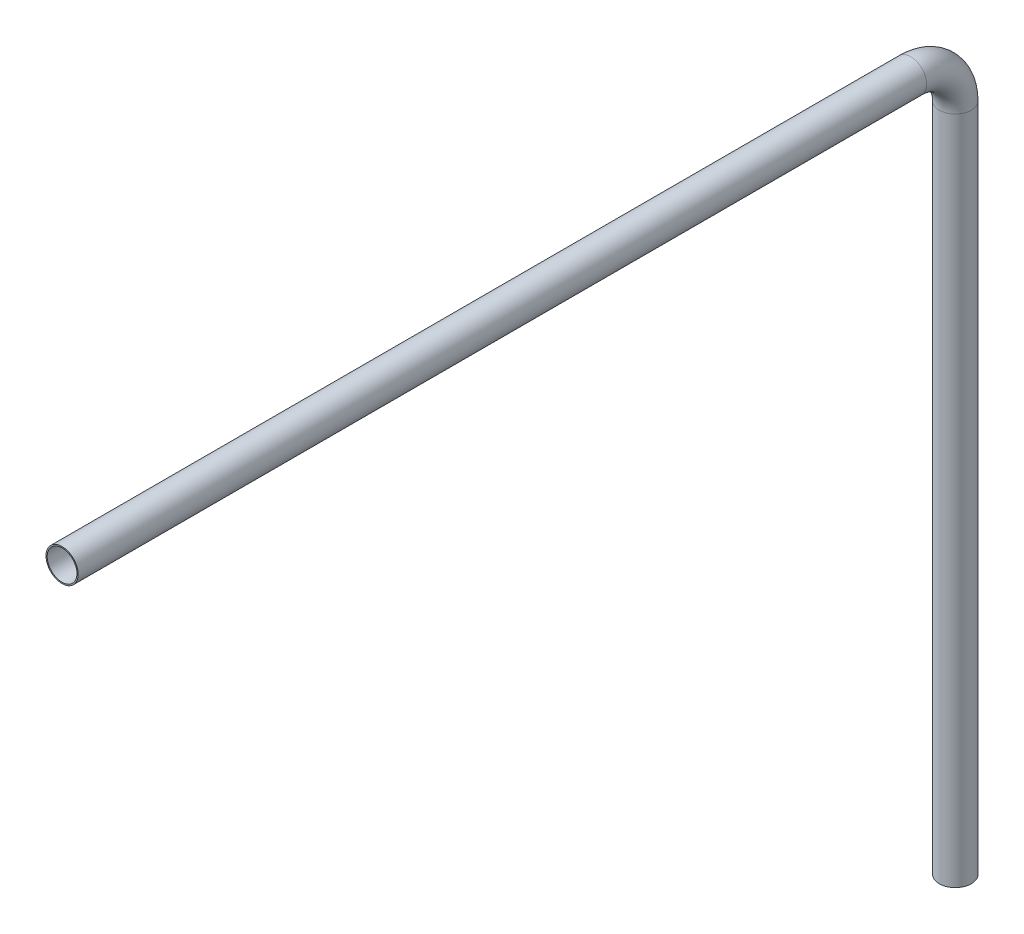
from build123d import *

# Parameters (mm, degrees)
SKETCH2_R           = 54
SKETCH2_R_2         = 50
SKETCH3_R           = 54
SKETCH3_R_2         = 50
BOSS_EXTRUDE1_DEPTH = 400


with BuildPart() as part:
    # Sweep1: sweep along a path in Sketch1
    with BuildLine(Plane(origin=(0, 0, 0), x_dir=(0, 0, -1), z_dir=(1, 0, 0))) as sweep1_path:
        Line((0, 0), (0, 1850))
        ThreePointArc((0, 1850), (-43.933982822, 1956.066017178), (-150, 2000))
        Line((-150, 2000), (-3000, 2000))
    # Sketch2 → Sweep1 (sweep)
    with BuildSketch(Plane(origin=(0, 0, 0), x_dir=(1, 0, 0), z_dir=(0, 1, 0))):
        Circle(SKETCH2_R)
        Circle(SKETCH2_R_2, mode=Mode.SUBTRACT)
    sweep(path=sweep1_path.line)

    # Sketch3 → Boss-Extrude1 (add)
    with BuildSketch(Plane.XZ):
        Circle(SKETCH3_R)
        Circle(SKETCH3_R_2, mode=Mode.SUBTRACT)
    extrude(amount=BOSS_EXTRUDE1_DEPTH)


solid = part.part
